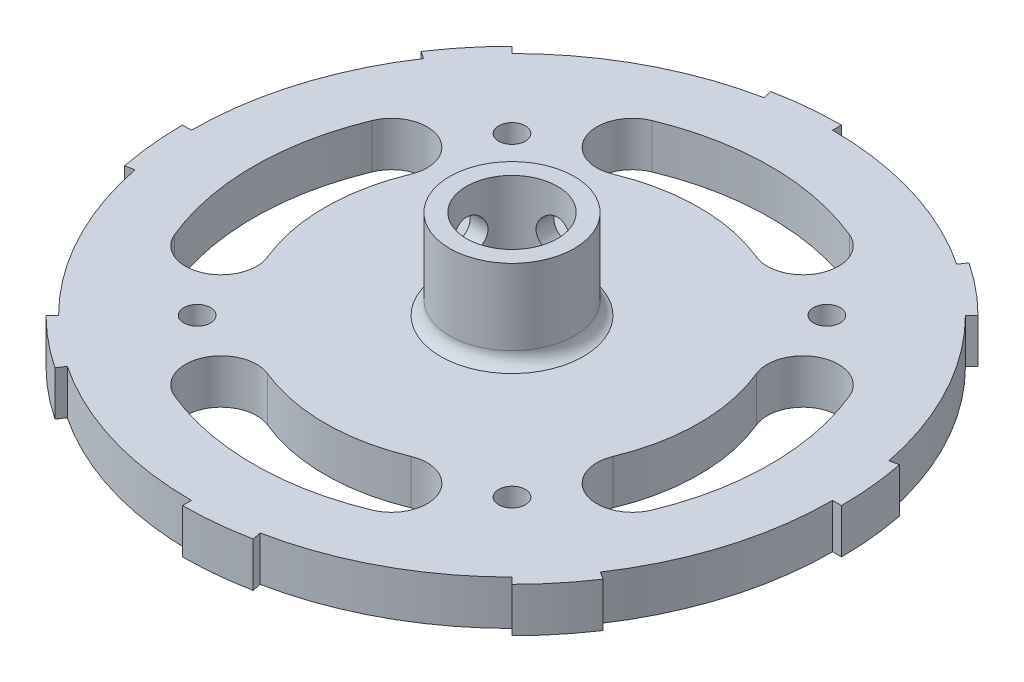
from build123d import *

# Parameters (mm, degrees)
SKETCH_1_R           = 37
EXTRUDE_1_DEPTH      = 40
SKETCH_2_R           = 5.1
CUT_EXTRUDE_1_DEPTH  = 40
CUT_EXTRUDE_2_DEPTH  = 40
SKETCH_4_R           = 7
SKETCH_4_R_2         = 5.1
EXTRUDE_2_DEPTH      = 10
CUT_EXTRUDE_3_REACH  = 74.374
CUT_EXTRUDE_4_REACH  = 74.374
CUT_EXTRUDE_7_REACH  = 74.374
EXTRUDE_START        = -40
SKETCH_14_R          = 36
EXTRUDE_4_DEPTH      = 40
CUT_EXTRUDE_11_DEPTH = 40
CUT_EXTRUDE_START    = -40
SKETCH_17_R          = 5.1
CUT_EXTRUDE_12_DEPTH = 40
SKETCH_21_R          = 37
CUT_EXTRUDE_14_DEPTH = 35
EXTRUDE_START_2      = -5
SKETCH_23_R          = 30
SKETCH_23_R_2        = 5.1
EXTRUDE_5_DEPTH      = 5
CUT_EXTRUDE_15_DEPTH = 5
SKETCH_25_R          = 1.5
CUT_EXTRUDE_16_DEPTH = 5
SKETCH_26_R          = 0.5
CUT_EXTRUDE_18_DEPTH = 2


with BuildPart() as part:
    # 草图1 → 凸台-拉伸1 (new body)
    with BuildSketch(Plane(origin=(0, 0, 0), x_dir=(1, 0, 0), z_dir=(0, 1, 0))):
        Circle(SKETCH_1_R)
    extrude(amount=EXTRUDE_1_DEPTH)

    # 草图2 → 切除-拉伸1 (cut)
    with BuildSketch(Plane(origin=(0, 40, 0), x_dir=(1, 0, 0), z_dir=(0, 1, 0))):
        Circle(SKETCH_2_R)
    extrude(amount=-CUT_EXTRUDE_1_DEPTH, mode=Mode.SUBTRACT)

    # 草图3 → 切除-拉伸2 (cut)
    with BuildSketch(Plane(origin=(0, 40, 0), x_dir=(1, 0, 0), z_dir=(0, 1, 0))):
        with BuildLine():
            ThreePointArc((21.650635067, -12.500000048), (23.480762153, -19.330127042), (30.31088915, -17.499999969))
            ThreePointArc((30.31088915, -17.499999969), (35, 0), (30.31088915, 17.499999969))
            ThreePointArc((30.31088915, 17.499999969), (23.48076214, 19.330127034), (21.650635082, 12.500000023))
            ThreePointArc((21.650635082, 12.500000023), (25, -1.5e-08), (21.650635067, -12.500000048))
        make_face()
        with BuildLine():
            ThreePointArc((-4e-09, 25), (5, 30.000000012), (-2.8e-08, 35))
            ThreePointArc((-2.8e-08, 35), (-17.500000023, 30.310889119), (-30.310889145, 17.499999978))
            ThreePointArc((-30.310889145, 17.499999978), (-28.480762154, 10.669873005), (-21.650635155, 12.499999896))
            ThreePointArc((-21.650635155, 12.499999896), (-12.500000054, 21.650635064), (-4e-09, 25))
        make_face()
        with BuildLine():
            ThreePointArc((1.4e-07, -35), (5, -29.99999992), (-1.9e-08, -25))
            ThreePointArc((-1.9e-08, -25), (-12.499999982, -21.650635105), (-21.650635064, -12.500000053))
            ThreePointArc((-21.650635064, -12.500000053), (-28.480762025, -10.66987293), (-30.310889204, -17.499999877))
            ThreePointArc((-30.310889204, -17.499999877), (-17.500000001, -30.310889132), (1.4e-07, -35))
        make_face()
    extrude(amount=-CUT_EXTRUDE_2_DEPTH, mode=Mode.SUBTRACT)

    # 草图4 → 凸台-拉伸2 (add, symmetric)
    with BuildSketch(Plane(origin=(0, 40, 0), x_dir=(1, 0, 0), z_dir=(0, 1, 0))):
        Circle(SKETCH_4_R)
        Circle(SKETCH_4_R_2, mode=Mode.SUBTRACT)
    extrude(amount=EXTRUDE_2_DEPTH, both=True)

    # 草图6 → 切除-拉伸3 (cut, up to next)
    with BuildSketch(Plane.XY, mode=Mode.PRIVATE) as cut_extrude_3_sk1:
        with BuildLine():
            ThreePointArc((0, 47), (-1.414213562, 43.585786438), (2, 45))
            ThreePointArc((2, 45), (1.414213562, 46.414213562), (0, 47))
        make_face()
    cut_extrude_3_tool1 = extrude(cut_extrude_3_sk1.sketch, amount=-CUT_EXTRUDE_3_REACH, mode=Mode.PRIVATE) & part.part
    add(cut_extrude_3_tool1.solids().sort_by_distance((0, 45, 0))[0], mode=Mode.SUBTRACT)

    # 草图7 → 切除-拉伸4 (cut, up to next)
    with BuildSketch(Plane(origin=(0, 0, 0), x_dir=(0, 0, -1), z_dir=(1, 0, 0)), mode=Mode.PRIVATE) as cut_extrude_4_sk1:
        with BuildLine():
            ThreePointArc((0, 47), (-1.414213562, 43.585786438), (2, 45))
            ThreePointArc((2, 45), (1.414213562, 46.414213562), (0, 47))
        make_face()
    cut_extrude_4_tool1 = extrude(cut_extrude_4_sk1.sketch, amount=-CUT_EXTRUDE_4_REACH, mode=Mode.PRIVATE) & part.part
    add(cut_extrude_4_tool1.solids().sort_by_distance((0, 45, 0))[0], mode=Mode.SUBTRACT)

    # 草图10 → 切除-拉伸7 (cut, up to next)
    with BuildSketch(Plane.XZ, mode=Mode.PRIVATE) as cut_extrude_7_sk1:
        with BuildLine():
            Line((0, 36), (0, 37))
            ThreePointArc((0, 37), (-10.740533058, 35.406792422), (-20.556098622, 30.764375655))
            Line((-20.556098622, 30.764375655), (-20.000528389, 29.932906043))
            ThreePointArc((-20.000528389, 29.932906043), (-10.450248381, 34.449852086), (0, 36))
        make_face()
    cut_extrude_7_tool1 = extrude(cut_extrude_7_sk1.sketch, amount=-CUT_EXTRUDE_7_REACH, mode=Mode.PRIVATE) & part.part
    # 草图10 → 切除-拉伸7 (cut, up to next)
    with BuildSketch(Plane.XZ, mode=Mode.PRIVATE) as cut_extrude_7_sk2:
        with BuildLine():
            Line((7.218341915, 36.289055375), (7.023251593, 35.308270095))
            ThreePointArc((7.023251593, 35.308270095), (16.970282526, 31.749165517), (25.455844123, 25.455844123))
            Line((25.455844123, 25.455844123), (26.162950904, 26.162950904))
            ThreePointArc((26.162950904, 26.162950904), (17.441679263, 32.631086781), (7.218341915, 36.289055375))
        make_face()
    cut_extrude_7_tool2 = extrude(cut_extrude_7_sk2.sketch, amount=-CUT_EXTRUDE_7_REACH, mode=Mode.PRIVATE) & part.part
    # 草图10 → 切除-拉伸7 (cut, up to next)
    with BuildSketch(Plane.XZ, mode=Mode.PRIVATE) as cut_extrude_7_sk3:
        with BuildLine():
            Line((30.764375655, 20.556098622), (29.932906043, 20.000528389))
            ThreePointArc((29.932906043, 20.000528389), (34.449852086, 10.450248381), (36, 0))
            Line((36, 0), (37, 0))
            ThreePointArc((37, 0), (35.406792422, 10.740533058), (30.764375655, 20.556098622))
        make_face()
    cut_extrude_7_tool3 = extrude(cut_extrude_7_sk3.sketch, amount=-CUT_EXTRUDE_7_REACH, mode=Mode.PRIVATE) & part.part
    # 草图10 → 切除-拉伸7 (cut, up to next)
    with BuildSketch(Plane.XZ, mode=Mode.PRIVATE) as cut_extrude_7_sk4:
        with BuildLine():
            Line((36.289055375, -7.218341915), (35.308270095, -7.023251593))
            ThreePointArc((35.308270095, -7.023251593), (31.749165517, -16.970282526), (25.455844123, -25.455844123))
            Line((25.455844123, -25.455844123), (26.162950904, -26.162950904))
            ThreePointArc((26.162950904, -26.162950904), (32.631086781, -17.441679263), (36.289055375, -7.218341915))
        make_face()
    cut_extrude_7_tool4 = extrude(cut_extrude_7_sk4.sketch, amount=-CUT_EXTRUDE_7_REACH, mode=Mode.PRIVATE) & part.part
    # 草图10 → 切除-拉伸7 (cut, up to next)
    with BuildSketch(Plane.XZ, mode=Mode.PRIVATE) as cut_extrude_7_sk5:
        with BuildLine():
            Line((20.556098622, -30.764375655), (20.000528389, -29.932906043))
            ThreePointArc((20.000528389, -29.932906043), (10.450248381, -34.449852086), (0, -36))
            Line((0, -36), (0, -37))
            ThreePointArc((0, -37), (10.740533058, -35.406792422), (20.556098622, -30.764375655))
        make_face()
    cut_extrude_7_tool5 = extrude(cut_extrude_7_sk5.sketch, amount=-CUT_EXTRUDE_7_REACH, mode=Mode.PRIVATE) & part.part
    # 草图10 → 切除-拉伸7 (cut, up to next)
    with BuildSketch(Plane.XZ, mode=Mode.PRIVATE) as cut_extrude_7_sk6:
        with BuildLine():
            Line((-7.218341915, -36.289055375), (-7.023251593, -35.308270095))
            ThreePointArc((-7.023251593, -35.308270095), (-16.970282526, -31.749165517), (-25.455844123, -25.455844123))
            Line((-25.455844123, -25.455844123), (-26.162950904, -26.162950904))
            ThreePointArc((-26.162950904, -26.162950904), (-17.441679263, -32.631086781), (-7.218341915, -36.289055375))
        make_face()
    cut_extrude_7_tool6 = extrude(cut_extrude_7_sk6.sketch, amount=-CUT_EXTRUDE_7_REACH, mode=Mode.PRIVATE) & part.part
    # 草图10 → 切除-拉伸7 (cut, up to next)
    with BuildSketch(Plane.XZ, mode=Mode.PRIVATE) as cut_extrude_7_sk7:
        with BuildLine():
            Line((-30.764375655, -20.556098622), (-29.932906043, -20.000528389))
            ThreePointArc((-29.932906043, -20.000528389), (-34.449852086, -10.450248381), (-36, 0))
            Line((-36, 0), (-37, 0))
            ThreePointArc((-37, 0), (-35.406792422, -10.740533058), (-30.764375655, -20.556098622))
        make_face()
    cut_extrude_7_tool7 = extrude(cut_extrude_7_sk7.sketch, amount=-CUT_EXTRUDE_7_REACH, mode=Mode.PRIVATE) & part.part
    # 草图10 → 切除-拉伸7 (cut, up to next)
    with BuildSketch(Plane.XZ, mode=Mode.PRIVATE) as cut_extrude_7_sk8:
        with BuildLine():
            Line((-36.289055375, 7.218341915), (-35.308270095, 7.023251593))
            ThreePointArc((-35.308270095, 7.023251593), (-31.749165517, 16.970282526), (-25.455844123, 25.455844123))
            Line((-25.455844123, 25.455844123), (-26.162950904, 26.162950904))
            ThreePointArc((-26.162950904, 26.162950904), (-32.631086781, 17.441679263), (-36.289055375, 7.218341915))
        make_face()
    cut_extrude_7_tool8 = extrude(cut_extrude_7_sk8.sketch, amount=-CUT_EXTRUDE_7_REACH, mode=Mode.PRIVATE) & part.part
    add(cut_extrude_7_tool1.solids().sort_by_distance((-0.21737, 0, 36.5))[0], mode=Mode.SUBTRACT)
    add(cut_extrude_7_tool2.solids().sort_by_distance((25.653884, 0, 25.964911))[0], mode=Mode.SUBTRACT)
    add(cut_extrude_7_tool3.solids().sort_by_distance((36.5, 0, 0.21737))[0], mode=Mode.SUBTRACT)
    add(cut_extrude_7_tool4.solids().sort_by_distance((25.964911, 0, -25.653884))[0], mode=Mode.SUBTRACT)
    add(cut_extrude_7_tool5.solids().sort_by_distance((0.21737, 0, -36.5))[0], mode=Mode.SUBTRACT)
    add(cut_extrude_7_tool6.solids().sort_by_distance((-25.653884, 0, -25.964911))[0], mode=Mode.SUBTRACT)
    add(cut_extrude_7_tool7.solids().sort_by_distance((-36.5, 0, -0.21737))[0], mode=Mode.SUBTRACT)
    add(cut_extrude_7_tool8.solids().sort_by_distance((-25.964911, 0, 25.653884))[0], mode=Mode.SUBTRACT)

    # 草图14 → 凸台-拉伸4 (add)
    with BuildSketch(Plane(origin=(0, 40, 0), x_dir=(1, 0, 0), z_dir=(0, 1, 0)).offset(EXTRUDE_START)):
        Circle(SKETCH_14_R)
    extrude(amount=EXTRUDE_4_DEPTH)

    # 草图15 → 切除-拉伸11 (cut)
    with BuildSketch(Plane(origin=(0, 40, 0), x_dir=(1, 0, 0), z_dir=(0, 1, 0))):
        with BuildLine():
            ThreePointArc((20, 0), (25, -5), (30, 0))
            ThreePointArc((30, 0), (28.97777479, 7.764571347), (25.980762119, 14.99999999))
            ThreePointArc((25.980762119, 14.99999999), (19.150635111, 16.830127029), (17.320508062, 10.000000023))
            ThreePointArc((17.320508062, 10.000000023), (19.318516522, 5.176380915), (20, 0))
        make_face()
        with BuildLine():
            ThreePointArc((17.320508096, -9.999999964), (14.142135686, -14.142135561), (10.000000118, -17.320508008))
            ThreePointArc((10.000000118, -17.320508008), (8.169872923, -24.150634995), (14.999999918, -25.980762161))
            ThreePointArc((14.999999918, -25.980762161), (21.213203317, -21.213203554), (25.980761993, -15.000000208))
            ThreePointArc((25.980761993, -15.000000208), (24.150635217, -8.169873051), (17.320508096, -9.999999964))
        make_face()
        with BuildLine():
            ThreePointArc((10.0000001, 17.320508018), (16.830127018, 19.150635093), (15.000000104, 25.980762053))
            ThreePointArc((15.000000104, 25.980762053), (7.764571417, 28.977774771), (1.3e-08, 30))
            ThreePointArc((1.3e-08, 30), (-5, 24.999999982), (4.9e-08, 20))
            ThreePointArc((4.9e-08, 20), (5.176380982, 19.318516504), (10.0000001, 17.320508018))
        make_face()
        with BuildLine():
            ThreePointArc((-15.000000208, -25.980761993), (-7.764571442, -28.977774765), (5.6e-08, -30))
            ThreePointArc((5.6e-08, -30), (5, -24.999999981), (1.9e-08, -20))
            ThreePointArc((1.9e-08, -20), (-5.176380827, -19.318516546), (-9.999999881, -17.320508144))
            ThreePointArc((-9.999999881, -17.320508144), (-16.830126924, -19.150634931), (-15.000000208, -25.980761993))
        make_face()
        with BuildLine():
            ThreePointArc((-17.320508134, 9.999999899), (-14.142135725, 14.142135523), (-10.000000147, 17.320507991))
            ThreePointArc((-10.000000147, 17.320507991), (-8.169872936, 24.150635016), (-14.99999999, 25.980762119))
            ThreePointArc((-14.99999999, 25.980762119), (-21.213203332, 21.213203539), (-25.980761973, 15.000000244))
            ThreePointArc((-25.980761973, 15.000000244), (-24.150635267, 8.169873081), (-17.320508134, 9.999999899))
        make_face()
        with BuildLine():
            ThreePointArc((-30, -8.8e-08), (-28.97777479, -7.76457135), (-25.980762161, -14.999999918))
            ThreePointArc((-25.980762161, -14.999999918), (-19.150635148, -16.83012705), (-17.320508061, -10.000000025))
            ThreePointArc((-17.320508061, -10.000000025), (-19.318516522, -5.176380916), (-20, 0))
            ThreePointArc((-20, 0), (-25.000000044, 5), (-30, -8.8e-08))
        make_face()
    extrude(amount=-CUT_EXTRUDE_11_DEPTH, mode=Mode.SUBTRACT)

    # 草图17 → 切除-拉伸12 (cut)
    with BuildSketch(Plane(origin=(0, 40, 0), x_dir=(1, 0, 0), z_dir=(0, 1, 0)).offset(CUT_EXTRUDE_START)):
        Circle(SKETCH_17_R)
    extrude(amount=CUT_EXTRUDE_12_DEPTH, mode=Mode.SUBTRACT)

    # 草图20 → 旋转1 (revolve)
    with BuildSketch(Plane.XY):
        with BuildLine():
            Line((-7, 40), (-7, 41.500033854))
            ThreePointArc((-7, 41.500033854), (-7.278579145, 40.593565511), (-8.018154145, 40))
            Line((-8.018154145, 40), (-7, 40))
        make_face()
    revolve(axis=Axis((0, -950, 0), (0, 1, 0)))

    # 草图21 → 切除-拉伸14 (cut)
    with BuildSketch(Plane.XZ):
        Circle(SKETCH_21_R)
    extrude(amount=-CUT_EXTRUDE_14_DEPTH, mode=Mode.SUBTRACT)

    # 草图23 → 凸台-拉伸5 (add)
    with BuildSketch(Plane.XZ.offset(-35).offset(EXTRUDE_START_2)):
        Circle(SKETCH_23_R)
        Circle(SKETCH_23_R_2, mode=Mode.SUBTRACT)
    extrude(amount=EXTRUDE_5_DEPTH)

    # 草图24 → 切除-拉伸15 (cut)
    with BuildSketch(Plane.XZ.offset(-35)):
        with BuildLine():
            ThreePointArc((19.401470113, -8.036352248), (21.566254557, -13.262603928), (26.792506351, -11.09781976))
            ThreePointArc((26.792506351, -11.09781976), (29, -1.26e-07), (26.792506447, 11.097819528))
            ThreePointArc((26.792506447, 11.097819528), (21.566254619, 13.262603954), (19.401470158, 8.036352139))
            ThreePointArc((19.401470158, 8.036352139), (21, -5.9e-08), (19.401470113, -8.036352248))
        make_face()
        with BuildLine():
            ThreePointArc((8.036352002, 19.401470215), (13.26260387, 21.566254417), (11.097819794, 26.792506337))
            ThreePointArc((11.097819794, 26.792506337), (2.06e-07, 29), (-11.097819413, 26.792506495))
            ThreePointArc((-11.097819413, 26.792506495), (-13.262603965, 21.566254645), (-8.036352077, 19.401470184))
            ThreePointArc((-8.036352077, 19.401470184), (-4.1e-08, 21), (8.036352002, 19.401470215))
        make_face()
        with BuildLine():
            ThreePointArc((11.097819528, -26.792506447), (13.262603965, -21.566254646), (8.036352195, -19.401470135))
            ThreePointArc((8.036352195, -19.401470135), (-3e-09, -21), (-8.0363522, -19.401470133))
            ThreePointArc((-8.0363522, -19.401470133), (-13.262603948, -21.566254605), (-11.097819615, -26.792506411))
            ThreePointArc((-11.097819615, -26.792506411), (-4.8e-08, -29), (11.097819528, -26.792506447))
        make_face()
        with BuildLine():
            ThreePointArc((-19.401470215, 8.036352001), (-21.566254478, 13.262603896), (-26.792506388, 11.097819671))
            ThreePointArc((-26.792506388, 11.097819671), (-29, 1.55e-07), (-26.792506507, -11.097819384))
            ThreePointArc((-26.792506507, -11.097819384), (-21.566254645, -13.262603965), (-19.401470195, -8.036352049))
            ThreePointArc((-19.401470195, -8.036352049), (-21, -2.6e-08), (-19.401470215, 8.036352001))
        make_face()
    extrude(amount=-CUT_EXTRUDE_15_DEPTH, mode=Mode.SUBTRACT)

    # 草图25 → 切除-拉伸16 (cut)
    with BuildSketch(Plane.XZ.offset(-35)):
        with Locations((17.67766953, 17.67766953)):
            Circle(SKETCH_25_R)
        with Locations((17.67766953, -17.67766953)):
            Circle(SKETCH_25_R)
        with Locations((-17.67766953, 17.67766953)):
            Circle(SKETCH_25_R)
        with Locations((-17.67766953, -17.67766953)):
            Circle(SKETCH_25_R)
    extrude(amount=-CUT_EXTRUDE_16_DEPTH, mode=Mode.SUBTRACT)

    # 草图26 → 切除-拉伸18 (cut)
    with BuildSketch(Plane.XZ.offset(-35)):
        with Locations((-17.67766953, 20.17766953)):
            Circle(SKETCH_26_R)
        with Locations((-15.17766953, 17.67766953)):
            Circle(SKETCH_26_R)
        with Locations((-17.67766953, 15.17766953)):
            Circle(SKETCH_26_R)
        with Locations((-20.17766953, 17.67766953)):
            Circle(SKETCH_26_R)
        with Locations((-15.17766953, -17.67766953)):
            Circle(SKETCH_26_R)
        with Locations((-20.17766953, -17.67766953)):
            Circle(SKETCH_26_R)
        with Locations((-17.67766953, -15.17766953)):
            Circle(SKETCH_26_R)
        with Locations((-17.67766953, -20.17766953)):
            Circle(SKETCH_26_R)
        with Locations((20.17766953, -17.67766953)):
            Circle(SKETCH_26_R)
        with Locations((17.67766953, -20.17766953)):
            Circle(SKETCH_26_R)
        with Locations((15.17766953, -17.67766953)):
            Circle(SKETCH_26_R)
        with Locations((17.67766953, -15.17766953)):
            Circle(SKETCH_26_R)
        with Locations((15.17766953, 17.67766953)):
            Circle(SKETCH_26_R)
        with Locations((17.67766953, 15.17766953)):
            Circle(SKETCH_26_R)
        with Locations((17.67766953, 20.17766953)):
            Circle(SKETCH_26_R)
        with Locations((20.17766953, 17.67766953)):
            Circle(SKETCH_26_R)
    extrude(amount=-CUT_EXTRUDE_18_DEPTH, mode=Mode.SUBTRACT)


solid = part.part
